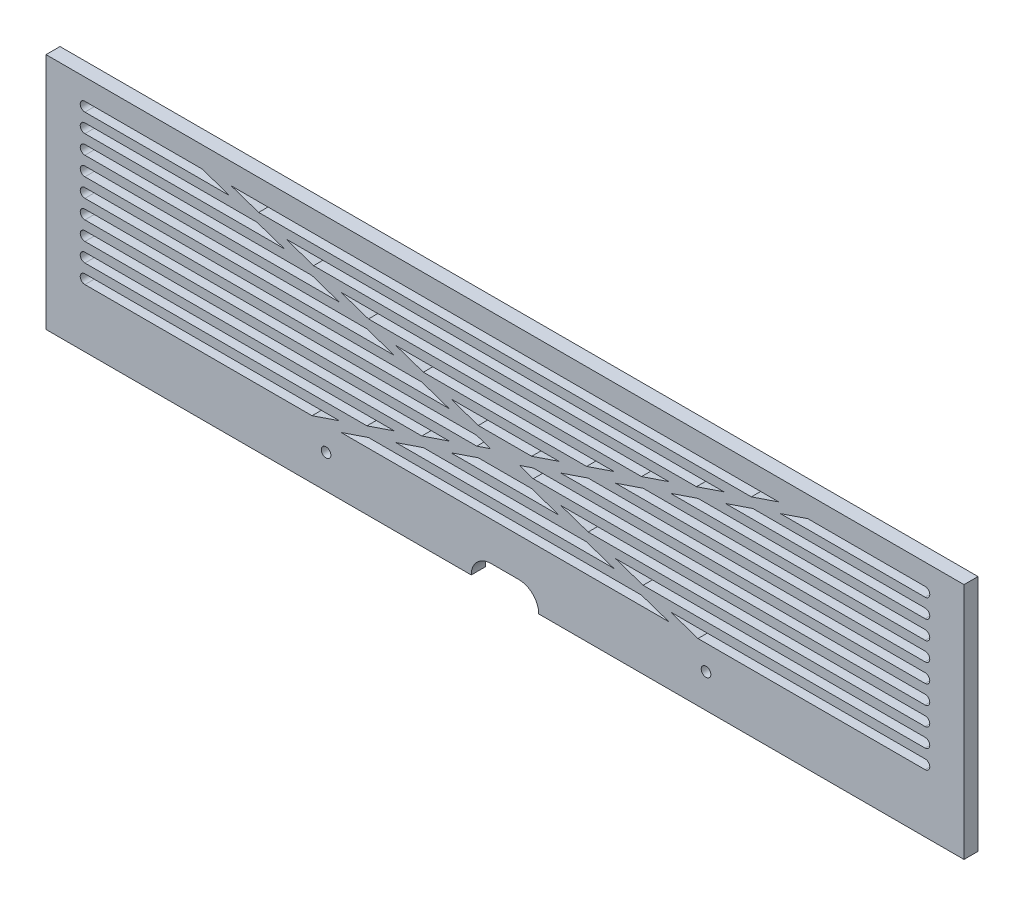
from build123d import *

# Parameters (mm, degrees)
SKETCH1_W           = 295
SKETCH1_H           = 76.5
BOSS_EXTRUDE1_DEPTH = 4.5
CUT_EXTRUDE1_REACH  = 154.445
SKETCH3_R           = 1.55
CUT_EXTRUDE2_DEPTH  = 14
CUT_EXTRUDE4_DEPTH  = 153.445277067
BOSS_EXTRUDE2_DEPTH = 4.5


with BuildPart() as part:
    # Sketch1 → Boss-Extrude1 (new body)
    with BuildSketch(Plane.XY):
        Rectangle(SKETCH1_W, SKETCH1_H)
    extrude(amount=BOSS_EXTRUDE1_DEPTH)

    # Sketch2 → Cut-Extrude1 (cut, up to next)
    with BuildSketch(Plane.XY.offset(4.5), mode=Mode.PRIVATE) as cut_extrude1_sk1:
        with BuildLine():
            Line((4.467819604, -44.629426527), (-4.467819604, -44.629426527))
            ThreePointArc((-4.467819604, -44.629426527), (-10.847246131, -38.25), (-4.467819604, -31.870573473))
            Line((-4.467819604, -31.870573473), (4.467819604, -31.870573473))
            ThreePointArc((4.467819604, -31.870573473), (10.847246131, -38.25), (4.467819604, -44.629426527))
        make_face()
    cut_extrude1_tool1 = extrude(cut_extrude1_sk1.sketch, amount=-CUT_EXTRUDE1_REACH, mode=Mode.PRIVATE) & part.part
    add(cut_extrude1_tool1.solids().sort_by_distance((0, -38.25, 4.5))[0], mode=Mode.SUBTRACT)

    # Sketch3 → Cut-Extrude2 (cut)
    with BuildSketch(Plane.XY.offset(4.5)):
        with Locations((64.6, -27.45)):
            Circle(SKETCH3_R)
        with Locations((-57.5, -27.45)):
            Circle(SKETCH3_R)
    extrude(amount=-CUT_EXTRUDE2_DEPTH, mode=Mode.SUBTRACT)

    # Sketch5 → Cut-Extrude4 (cut, through all)
    with BuildSketch(Plane.XY.offset(4.5)):
        with BuildLine():
            Line((135, 28.5), (-135, 28.5))
            ThreePointArc((-135, 28.5), (-136.5, 30), (-135, 31.5))
            Line((-135, 31.5), (135, 31.5))
            ThreePointArc((135, 31.5), (136.5, 30), (135, 28.5))
        make_face()
        with BuildLine():
            Line((135, 22.5), (-135, 22.5))
            ThreePointArc((-135, 22.5), (-136.5, 24), (-135, 25.5))
            Line((-135, 25.5), (135, 25.5))
            ThreePointArc((135, 25.5), (136.5, 24), (135, 22.5))
        make_face()
        with BuildLine():
            Line((135, 16.5), (-135, 16.5))
            ThreePointArc((-135, 16.5), (-136.5, 18), (-135, 19.5))
            Line((-135, 19.5), (135, 19.5))
            ThreePointArc((135, 19.5), (136.5, 18), (135, 16.5))
        make_face()
        with BuildLine():
            Line((135, 10.5), (-135, 10.5))
            ThreePointArc((-135, 10.5), (-136.5, 12), (-135, 13.5))
            Line((-135, 13.5), (135, 13.5))
            ThreePointArc((135, 13.5), (136.5, 12), (135, 10.5))
        make_face()
        with BuildLine():
            Line((135, 4.5), (-135, 4.5))
            ThreePointArc((-135, 4.5), (-136.5, 6), (-135, 7.5))
            Line((-135, 7.5), (135, 7.5))
            ThreePointArc((135, 7.5), (136.5, 6), (135, 4.5))
        make_face()
        with BuildLine():
            Line((135, -1.5), (-135, -1.5))
            ThreePointArc((-135, -1.5), (-136.5, 0), (-135, 1.5))
            Line((-135, 1.5), (135, 1.5))
            ThreePointArc((135, 1.5), (136.5, 0), (135, -1.5))
        make_face()
        with BuildLine():
            Line((135, -7.5), (-135, -7.5))
            ThreePointArc((-135, -7.5), (-136.5, -6), (-135, -4.5))
            Line((-135, -4.5), (135, -4.5))
            ThreePointArc((135, -4.5), (136.5, -6), (135, -7.5))
        make_face()
        with BuildLine():
            Line((135, -13.5), (-135, -13.5))
            ThreePointArc((-135, -13.5), (-136.5, -12), (-135, -10.5))
            Line((-135, -10.5), (135, -10.5))
            ThreePointArc((135, -10.5), (136.5, -12), (135, -13.5))
        make_face()
        with BuildLine():
            Line((135, -19.5), (-135, -19.5))
            ThreePointArc((-135, -19.5), (-136.5, -18), (-135, -16.5))
            Line((-135, -16.5), (135, -16.5))
            ThreePointArc((135, -16.5), (136.5, -18), (135, -19.5))
        make_face()
    extrude(amount=-CUT_EXTRUDE4_DEPTH, mode=Mode.SUBTRACT)

    # Sketch6 → Boss-Extrude2 (add)
    with BuildSketch(Plane.XY.offset(4.5)):
        with BuildLine():
            Line((-100.4828541, -32.579840883), (99.5171459, 35.420159117))
            ThreePointArc((99.5171459, 35.420159117), (101.420159117, 34.4828541), (100.4828541, 32.579840883))
            Line((100.4828541, 32.579840883), (-99.5171459, -35.420159117))
            ThreePointArc((-99.5171459, -35.420159117), (-101.420159117, -34.4828541), (-100.4828541, -32.579840883))
        make_face()
        with BuildLine():
            Line((99.5171459, -35.420159117), (-100.4828541, 32.579840883))
            ThreePointArc((-100.4828541, 32.579840883), (-101.420159117, 34.4828541), (-99.5171459, 35.420159117))
            Line((-99.5171459, 35.420159117), (100.4828541, -32.579840883))
            ThreePointArc((100.4828541, -32.579840883), (101.420159117, -34.4828541), (99.5171459, -35.420159117))
        make_face()
    extrude(amount=-BOSS_EXTRUDE2_DEPTH)


solid = part.part
